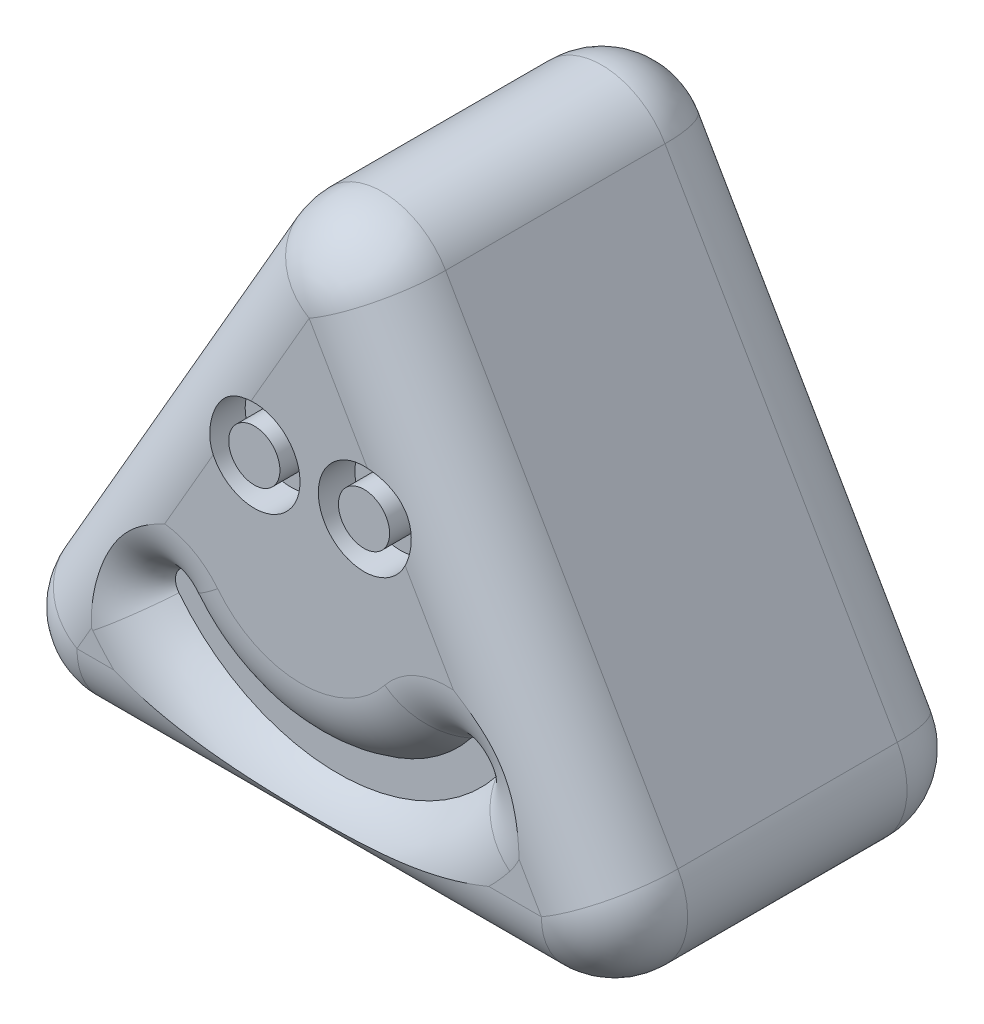
from build123d import *

# Parameters (mm, degrees)
BOSS_EXTRUDE1_DEPTH = 10
CUT_EXTRUDE1_DEPTH  = 1
FILLET1_R           = 2
SKETCH3_R           = 1.25
SKETCH3_R_2         = 0.7
CUT_EXTRUDE2_DEPTH  = 1
BOSS_EXTRUDE2_DEPTH = 2


with BuildPart() as part:
    # Sketch1 → Boss-Extrude1 (new body)
    with BuildSketch(Plane.XY):
        Polygon((-9.814954576, -17), (9.814954576, -17), (0, 0), align=None)
    extrude(amount=BOSS_EXTRUDE1_DEPTH)

    # Sketch2 → Cut-Extrude1 (cut)
    with BuildSketch(Plane.XY.offset(10)):
        with BuildLine():
            ThreePointArc((-4.55976672, -13.28190161), (-0.216174522, -15.38675653), (4.127417675, -13.28190161))
            ThreePointArc((4.127417675, -13.28190161), (4.053734797, -12.655479816), (3.427313004, -12.729162694))
            ThreePointArc((3.427313004, -12.729162694), (-0.216174522, -14.494754927), (-3.859662049, -12.729162694))
            ThreePointArc((-3.859662049, -12.729162694), (-4.486083842, -12.655479816), (-4.55976672, -13.28190161))
        make_face()
    extrude(amount=-CUT_EXTRUDE1_DEPTH, mode=Mode.SUBTRACT)

    # Fillet1
    # the kernel refuses this fillet: 2 mm, written as the material it takes off along each edge
    with BuildSketch(Plane(origin=(6.350852961, -15, 2), x_dir=(0, -1, 0), z_dir=(0, 0, -1))) as fillet1_piece_1_section:
        Polygon((0, 0), (FILLET1_R * 1.02, 0), (FILLET1_R * 1.02, -FILLET1_R * 1.76669182372), (-FILLET1_R * 0.51, -FILLET1_R * 0.88334591186), align=None)
    fillet1_piece_1 = extrude(amount=FILLET1_R * 1.02, mode=Mode.PRIVATE)
    fillet1_piece_1 = fillet1_piece_1 - Plane(origin=(6.350852961, -15, 2), x_dir=(-0.8660254037844387, 0.4999999999999999, 0), z_dir=(0, 0, -1)) * Sphere(FILLET1_R, mode=Mode.PRIVATE)
    add(fillet1_piece_1, mode=Mode.SUBTRACT)
    with BuildSketch(Plane(origin=(6.350852961, -15, 8), x_dir=(0, -1, 0), z_dir=(0, 0, 1))) as fillet1_piece_2_section:
        Polygon((0, 0), (FILLET1_R * 1.02, 0), (FILLET1_R * 1.02, FILLET1_R * 1.76669182372), (-FILLET1_R * 0.51, FILLET1_R * 0.88334591186), align=None)
    fillet1_piece_2 = extrude(amount=FILLET1_R * 1.02, mode=Mode.PRIVATE)
    fillet1_piece_2 = fillet1_piece_2 - Plane(origin=(6.350852961, -15, 8), x_dir=(-0.8660254037844387, 0.4999999999999999, 0), z_dir=(0, 0, 1)) * Sphere(FILLET1_R, mode=Mode.PRIVATE)
    add(fillet1_piece_2, mode=Mode.SUBTRACT)
    with BuildSketch(Plane(origin=(0, -4, 2), x_dir=(-0.8660254037844387, 0.5000000000000001, 0), z_dir=(0, 0, -1))) as fillet1_piece_3_section:
        Polygon((0, 0), (FILLET1_R * 1.02, 0), (FILLET1_R * 1.02, FILLET1_R * 1.76669182372), (-FILLET1_R * 0.51, FILLET1_R * 0.88334591186), align=None)
    fillet1_piece_3 = extrude(amount=FILLET1_R * 1.02, mode=Mode.PRIVATE)
    fillet1_piece_3 = fillet1_piece_3 - Plane(origin=(0, -4, 2), x_dir=(0, -1, 0), z_dir=(0, 0, -1)) * Sphere(FILLET1_R, mode=Mode.PRIVATE)
    add(fillet1_piece_3, mode=Mode.SUBTRACT)
    with BuildSketch(Plane(origin=(0, -4, 8), x_dir=(-0.8660254037844387, 0.5000000000000001, 0), z_dir=(0, 0, 1))) as fillet1_piece_4_section:
        Polygon((0, 0), (FILLET1_R * 1.02, 0), (FILLET1_R * 1.02, -FILLET1_R * 1.76669182372), (-FILLET1_R * 0.51, -FILLET1_R * 0.88334591186), align=None)
    fillet1_piece_4 = extrude(amount=FILLET1_R * 1.02, mode=Mode.PRIVATE)
    fillet1_piece_4 = fillet1_piece_4 - Plane(origin=(0, -4, 8), x_dir=(0, -1, 0), z_dir=(0, 0, 1)) * Sphere(FILLET1_R, mode=Mode.PRIVATE)
    add(fillet1_piece_4, mode=Mode.SUBTRACT)
    with BuildSketch(Plane(origin=(-6.350852961, -15, 8), x_dir=(0, -1, 0), z_dir=(0, 0, 1))) as fillet1_piece_5_section:
        Polygon((0, 0), (FILLET1_R * 1.02, 0), (FILLET1_R * 1.02, -FILLET1_R * 1.76669182372), (-FILLET1_R * 0.51, -FILLET1_R * 0.88334591186), align=None)
    fillet1_piece_5 = extrude(amount=FILLET1_R * 1.02, mode=Mode.PRIVATE)
    fillet1_piece_5 = fillet1_piece_5 - Plane(origin=(-6.350852961, -15, 8), x_dir=(0.8660254037844387, 0.4999999999999999, 0), z_dir=(0, 0, 1)) * Sphere(FILLET1_R, mode=Mode.PRIVATE)
    add(fillet1_piece_5, mode=Mode.SUBTRACT)
    with BuildSketch(Plane(origin=(-6.350852961, -15, 2), x_dir=(0, -1, 0), z_dir=(0, 0, -1))) as fillet1_piece_6_section:
        Polygon((0, 0), (FILLET1_R * 1.02, 0), (FILLET1_R * 1.02, FILLET1_R * 1.76669182372), (-FILLET1_R * 0.51, FILLET1_R * 0.88334591186), align=None)
    fillet1_piece_6 = extrude(amount=FILLET1_R * 1.02, mode=Mode.PRIVATE)
    fillet1_piece_6 = fillet1_piece_6 - Plane(origin=(-6.350852961, -15, 2), x_dir=(0.8660254037844387, 0.4999999999999999, 0), z_dir=(0, 0, -1)) * Sphere(FILLET1_R, mode=Mode.PRIVATE)
    add(fillet1_piece_6, mode=Mode.SUBTRACT)
    with BuildSketch(Plane(origin=(9.814954576, -17, 2), x_dir=(-1, 0, 0), z_dir=(0, 0, 1))) as fillet1_piece_7:
        with BuildLine():
            CenterArc((FILLET1_R * 1.73205080757, -FILLET1_R), FILLET1_R, 90, 120)
            Line((FILLET1_R * 0.866025403784, -FILLET1_R * 1.5), (0, 0))
            Line((0, 0), (FILLET1_R * 1.73205080757, 0))
        make_face()
    extrude(amount=6, mode=Mode.SUBTRACT)
    with BuildSketch(Plane(origin=(0, 0, 2), x_dir=(-0.5000000000000001, -0.8660254037844386, 0), z_dir=(0, 0, 1)), Plane(origin=(-9.814954576, -17, 2), x_dir=(1, 0, 0), z_dir=(0, 0, 1))) as fillet1_piece_8:
        with BuildLine():
            CenterArc((FILLET1_R * 1.73205080757, FILLET1_R), FILLET1_R, 150, 120)
            Line((FILLET1_R * 0.866025403784, FILLET1_R * 1.5), (0, 0))
            Line((0, 0), (FILLET1_R * 1.73205080757, 0))
        make_face()
    extrude(amount=6, mode=Mode.SUBTRACT)
    with BuildSketch(Plane(origin=(8.082903769, -14, 0), x_dir=(0, 0, 1), z_dir=(-0.5000000000000001, 0.8660254037844387, 0)), Plane(origin=(-1.732050808, -3, 0), x_dir=(0, 0, 1), z_dir=(-0.5000000000000001, -0.8660254037844387, 0)), Plane(origin=(-6.350852961, -17, 0), x_dir=(0, 0, 1), z_dir=(1, 0, 0))) as fillet1_piece_9:
        with BuildLine():
            CenterArc((FILLET1_R, -FILLET1_R), FILLET1_R, 90, 90)
            Line((0, -FILLET1_R), (0, 0))
            Line((0, 0), (FILLET1_R, 0))
        make_face()
    extrude(amount=12.701705922, mode=Mode.SUBTRACT)
    with BuildSketch(Plane(origin=(8.082903769, -14, 10), x_dir=(0, 0, -1), z_dir=(-0.5000000000000001, 0.8660254037844387, 0)), Plane(origin=(-6.350852961, -17, 10), x_dir=(0, 0, -1), z_dir=(1, 0, 0)), Plane(origin=(-1.732050808, -3, 10), x_dir=(0, 0, -1), z_dir=(-0.5000000000000001, -0.8660254037844387, 0))) as fillet1_piece_10:
        with BuildLine():
            CenterArc((FILLET1_R, FILLET1_R), FILLET1_R, 180, 90)
            Line((0, FILLET1_R), (0, 0))
            Line((0, 0), (FILLET1_R, 0))
        make_face()
    extrude(amount=12.701705922, mode=Mode.SUBTRACT)
    with BuildSketch(Plane(origin=(-0.216174522, -9.852596625, 10), x_dir=(-0.7848692976014117, -0.6196613475783904, 0), z_dir=(-0.6196613475783904, 0.7848692976014117, 0))) as fillet1_piece_11:
        with BuildLine():
            CenterArc((7.266210713, -2), FILLET1_R, 90, 60)
            Line((5.534159905, -1), (5.534159905, 0))
            Line((5.534159905, 0), (7.266210713, 0))
        make_face()
    revolve(axis=Axis((-0.216174522, -9.852596625, 10), (0, 0, 1)), revolution_arc=103.417183009, mode=Mode.SUBTRACT)
    with BuildSketch(Plane(origin=(3.77736534, -13.005532152, 10), x_dir=(0.7848692976014108, -0.6196613475783915, 0), z_dir=(-0.6196613475783915, -0.7848692976014108, 0))) as fillet1_piece_12:
        with BuildLine():
            CenterArc((2.178051609, -2), FILLET1_R, 90, 60)
            Line((0.446000801, -1), (0.446000801, 0))
            Line((0.446000801, 0), (2.178051609, 0))
        make_face()
    revolve(axis=Axis((3.77736534, -13.005532152, 10), (0, 0, 1)), revolution_arc=180, mode=Mode.SUBTRACT)
    with BuildSketch(Plane(origin=(-0.216174522, -9.852596625, 10), x_dir=(0.7848692976014113, -0.6196613475783908, 0), z_dir=(0.6196613475783908, 0.7848692976014113, 0))) as fillet1_piece_13:
        with BuildLine():
            CenterArc((2.910107495, 2), FILLET1_R, 270, 60)
            Line((4.642158302, 1), (4.642158302, 0))
            Line((4.642158302, 0), (2.910107495, 0))
        make_face()
    revolve(axis=Axis((-0.216174522, -9.852596625, 10), (0, 0, -1)), revolution_arc=103.417183009, mode=Mode.SUBTRACT)
    with BuildSketch(Plane(origin=(-4.209714384, -13.005532152, 10), x_dir=(0.7848692976014146, 0.6196613475783866, 0), z_dir=(0.6196613475783866, -0.7848692976014146, 0))) as fillet1_piece_14:
        with BuildLine():
            CenterArc((2.178051609, -2), FILLET1_R, 90, 60)
            Line((0.446000801, -1), (0.446000801, 0))
            Line((0.446000801, 0), (2.178051609, 0))
        make_face()
    revolve(axis=Axis((-4.209714384, -13.005532152, 10), (0, 0, 1)), revolution_arc=180, mode=Mode.SUBTRACT)

    # Sketch3 → Cut-Extrude2 (cut)
    # profile 1 of 2: a face of its own
    with BuildSketch(Plane.XY.offset(10)):
        with Locations((1.5, -8)):
            Circle(SKETCH3_R)
        with Locations((1.5, -8)):
            Circle(SKETCH3_R_2, mode=Mode.SUBTRACT)
    # profile 2 of 2: a face of its own
    with BuildSketch(Plane.XY.offset(10)):
        with Locations(Location((-1.5, -8, 0), (0, 0, 94.109031583))):
            Circle(SKETCH3_R)
        with Locations((-1.5, -8)):
            Circle(SKETCH3_R_2, mode=Mode.SUBTRACT)
    extrude(amount=-CUT_EXTRUDE2_DEPTH, mode=Mode.SUBTRACT)

    # Sketch4 → Boss-Extrude2 (add)
    with BuildSketch(Plane.XZ.offset(17)):
        with BuildLine():
            Line((-4, 5.9), (4, 5.9))
            ThreePointArc((4, 5.9), (4.9, 5), (4, 4.1))
            Line((4, 4.1), (-4, 4.1))
            ThreePointArc((-4, 4.1), (-4.9, 5), (-4, 5.9))
        make_face()
    extrude(amount=BOSS_EXTRUDE2_DEPTH)


solid = part.part
